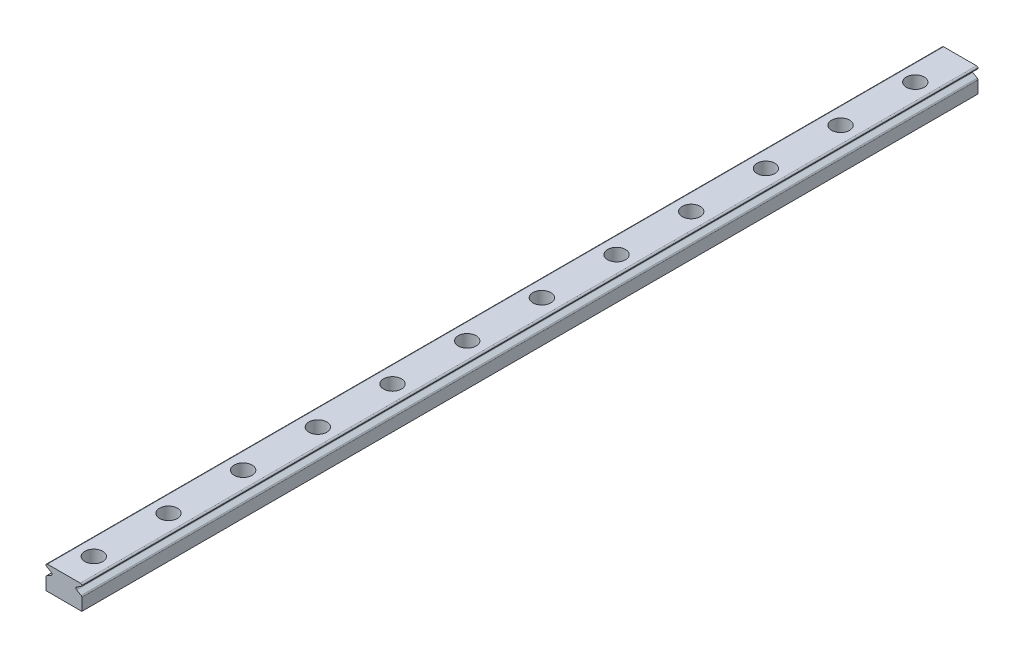
from build123d import *

# Parameters (mm, degrees)
BOSS_EXTRUDE2_DEPTH = 300
FILLET5_R           = 0.5
SKETCH3_R           = 3
CUT_EXTRUDE2_DEPTH  = 4.5
SKETCH4_R           = 1.75
CUT_EXTRUDE3_DEPTH  = 14.5
SKETCH5_W           = 12
SKETCH5_H           = 4.057387372
CUT_EXTRUDE4_DEPTH  = 682.5


with BuildPart() as part:
    # Sketch1 → Boss-Extrude2 (new body)
    with BuildSketch(Plane.XY):
        Polygon((0, 0), (12, 0), (12, 8.403449878), (9.5, 9.846825551), (12, 11.290201224), (12, 12), (0, 12), (0, 11.290201224), (2.5, 9.846825551), (0, 8.403449878), align=None)
    extrude(amount=BOSS_EXTRUDE2_DEPTH)

    # Fillet5
    # the kernel refuses this fillet: 0.5 mm, written as the material it adds along each edge
    with BuildSketch(Plane(origin=(2.5, 9.846825551, 0), x_dir=(-0.8660254037844382, 0.5000000000000009, 0), z_dir=(0, 0, 1)), Plane(origin=(9.5, 9.846825551, 0), x_dir=(0.8660254037844379, -0.5000000000000013, 0), z_dir=(0, 0, 1))) as fillet5_piece_1:
        with BuildLine():
            CenterArc((FILLET5_R * 1.73205080757, FILLET5_R), FILLET5_R, 150, 120)
            Line((FILLET5_R * 0.866025403784, FILLET5_R * 1.5), (0, 0))
            Line((0, 0), (FILLET5_R * 1.73205080757, 0))
        make_face()
    extrude(amount=300)
    # the kernel refuses this fillet: 0.5 mm, written as the material it takes off along each edge
    with BuildSketch(Plane(origin=(0, 8.403449878, -0.721687836), x_dir=(0, -1, 0), z_dir=(0, 0, 1))) as fillet5_2_piece_1:
        with BuildLine():
            CenterArc((FILLET5_R * 0.57735026919, FILLET5_R), FILLET5_R, 210, 60)
            Line((-FILLET5_R * 0.288675134595, FILLET5_R * 0.5), (0, 0))
            Line((0, 0), (FILLET5_R * 0.57735026919, 0))
        make_face()
    extrude(amount=301.443375673, mode=Mode.SUBTRACT)
    with BuildSketch(Plane(origin=(0, 11.290201224, -0.721687836), x_dir=(0, 1, 0), z_dir=(0, 0, 1)), Plane(origin=(12, 11.290201224, -0.721687836), x_dir=(-0.8660254037844355, -0.5000000000000052, 0), z_dir=(0, 0, 1)), Plane(origin=(12, 8.403449878, -0.721687836), x_dir=(0, -1, 0), z_dir=(0, 0, 1))) as fillet5_2_piece_2:
        with BuildLine():
            CenterArc((FILLET5_R * 0.57735026919, -FILLET5_R), FILLET5_R, 90, 60)
            Line((-FILLET5_R * 0.288675134595, -FILLET5_R * 0.5), (0, 0))
            Line((0, 0), (FILLET5_R * 0.57735026919, 0))
        make_face()
    extrude(amount=301.443375673, mode=Mode.SUBTRACT)
    with BuildSketch(Plane(origin=(0, 12, -1.25), x_dir=(1, 0, 0), z_dir=(0, 0, 1)), Plane(origin=(12, 12, -1.25), x_dir=(0, -1, 0), z_dir=(0, 0, 1))) as fillet5_2_piece_3:
        with BuildLine():
            CenterArc((FILLET5_R, -FILLET5_R), FILLET5_R, 90, 90)
            Line((0, -FILLET5_R), (0, 0))
            Line((0, 0), (FILLET5_R, 0))
        make_face()
    extrude(amount=302.5, mode=Mode.SUBTRACT)

    # Sketch3 → Cut-Extrude2 (cut)
    with BuildSketch(Plane(origin=(0, 12, 0), x_dir=(1, 0, 0), z_dir=(0, 1, 0))):
        with Locations((6, -490)):
            Circle(SKETCH3_R)
        with Locations((6, -440)):
            Circle(SKETCH3_R)
        with Locations((6, -415)):
            Circle(SKETCH3_R)
        with Locations((6, -390)):
            Circle(SKETCH3_R)
        with Locations((6, -365)):
            Circle(SKETCH3_R)
        with Locations((6, -340)):
            Circle(SKETCH3_R)
        with Locations((6, -315)):
            Circle(SKETCH3_R)
        with Locations(Location((6, -290, 0), (0, 0, 180))):
            Circle(SKETCH3_R)
        with Locations(Location((6, -265, 0), (0, 0, 180))):
            Circle(SKETCH3_R)
        with Locations(Location((6, -240, 0), (0, 0, 180))):
            Circle(SKETCH3_R)
        with Locations(Location((6, -215, 0), (0, 0, 180))):
            Circle(SKETCH3_R)
        with Locations(Location((6, -190, 0), (0, 0, 180))):
            Circle(SKETCH3_R)
        with Locations(Location((6, -165, 0), (0, 0, 180))):
            Circle(SKETCH3_R)
        with Locations(Location((6, -140, 0), (0, 0, 180))):
            Circle(SKETCH3_R)
        with Locations(Location((6, -115, 0), (0, 0, 180))):
            Circle(SKETCH3_R)
        with Locations(Location((6, -90, 0), (0, 0, 180))):
            Circle(SKETCH3_R)
        with Locations(Location((6, -65, 0), (0, 0, 180))):
            Circle(SKETCH3_R)
        with Locations(Location((6, -40, 0), (0, 0, 180))):
            Circle(SKETCH3_R)
        with Locations(Location((6, -15, 0), (0, 0, 180))):
            Circle(SKETCH3_R)
        with Locations((6, -465)):
            Circle(SKETCH3_R)
    extrude(amount=-CUT_EXTRUDE2_DEPTH, mode=Mode.SUBTRACT)

    # Sketch4 → Cut-Extrude3 (cut)
    with BuildSketch(Plane(origin=(0, 12, 0), x_dir=(1, 0, 0), z_dir=(0, 1, 0))):
        with Locations(Location((6, -15, 0), (0, 0, 180))):
            Circle(SKETCH4_R)
        with Locations(Location((6, -40, 0), (0, 0, 180))):
            Circle(SKETCH4_R)
        with Locations(Location((6, -65, 0), (0, 0, 180))):
            Circle(SKETCH4_R)
        with Locations(Location((6, -90, 0), (0, 0, 180))):
            Circle(SKETCH4_R)
        with Locations(Location((6, -115, 0), (0, 0, 180))):
            Circle(SKETCH4_R)
        with Locations(Location((6, -140, 0), (0, 0, 180))):
            Circle(SKETCH4_R)
        with Locations(Location((6, -165, 0), (0, 0, 180))):
            Circle(SKETCH4_R)
        with Locations(Location((6, -190, 0), (0, 0, 180))):
            Circle(SKETCH4_R)
        with Locations(Location((6, -215, 0), (0, 0, 180))):
            Circle(SKETCH4_R)
        with Locations(Location((6, -240, 0), (0, 0, 180))):
            Circle(SKETCH4_R)
        with Locations(Location((6, -265, 0), (0, 0, 180))):
            Circle(SKETCH4_R)
        with Locations(Location((6, -290, 0), (0, 0, 180))):
            Circle(SKETCH4_R)
        with Locations((6, -315)):
            Circle(SKETCH4_R)
        with Locations((6, -340)):
            Circle(SKETCH4_R)
        with Locations((6, -365)):
            Circle(SKETCH4_R)
        with Locations((6, -390)):
            Circle(SKETCH4_R)
        with Locations((6, -415)):
            Circle(SKETCH4_R)
        with Locations((6, -440)):
            Circle(SKETCH4_R)
        with Locations((6, -465)):
            Circle(SKETCH4_R)
        with Locations((6, -490)):
            Circle(SKETCH4_R)
    extrude(amount=-CUT_EXTRUDE3_DEPTH, mode=Mode.SUBTRACT)

    # Sketch5 → Cut-Extrude4 (cut)
    with BuildSketch(Plane(origin=(0, 0, 0), x_dir=(-1, 0, 0), z_dir=(0, 0, -1))):
        with Locations((-6, 2.028693686)):
            Rectangle(SKETCH5_W, SKETCH5_H)
    extrude(amount=-CUT_EXTRUDE4_DEPTH, mode=Mode.SUBTRACT)


solid = part.part
